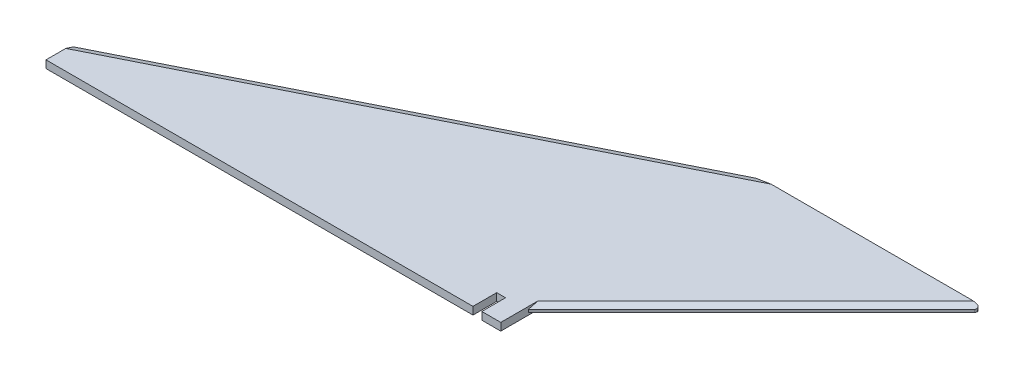
from build123d import *
from OCP.BRepFilletAPI import BRepFilletAPI_MakeChamfer

# Parameters (mm, degrees)
BOSS_EXTRUDE1_DEPTH = 3
CHAMFER1_SIZE       = 1
CHAMFER1_SIZE2      = 2.747477419
CHAMFER2_SIZE       = 1
CHAMFER2_SIZE2      = 2.747477419
FILLET1_R           = 1


with BuildPart() as part:
    # Sketch1 → Boss-Extrude1 (new body)
    with BuildSketch(Plane(origin=(0, 0, 0), x_dir=(1, 0, 0), z_dir=(0, 1, 0))):
        Polygon((0, 0), (0, 10.9), (180, 100.9), (270, 100.9), (180, 10.9), (180, 0), (172.5, 0), (172.5, 9.4), (169, 9.4), (169, 0), align=None)
    extrude(amount=BOSS_EXTRUDE1_DEPTH)

    # Chamfer1: one chamfer whose edges measure the first distance from different faces: ONE call of the kernel's chamfer builder (chamfer() names one face for all edges)
    chamfer1_edges_1 = [part.edges().sort_by_distance(p)[0] for p in [
        (225, 3, -55.9),
    ]]
    chamfer1_side_1 = [part.faces().sort_by_distance(p)[0] for p in [
        (225, 1.5, -55.9),
    ]]
    chamfer1_edges_2 = [part.edges().sort_by_distance(p)[0] for p in [
        (90, 3, -55.9),
    ]]
    chamfer1_side_2 = [part.faces().sort_by_distance(p)[0] for p in [
        (90, 1.5, -55.9),
    ]]
    chamfer1 = BRepFilletAPI_MakeChamfer(part.part.solid().wrapped)
    for e in chamfer1_edges_1:
        chamfer1.Add(CHAMFER1_SIZE, CHAMFER1_SIZE2, e.wrapped, chamfer1_side_1[0].wrapped)  # the first distance lies on this face
    for e in chamfer1_edges_2:
        chamfer1.Add(CHAMFER1_SIZE, CHAMFER1_SIZE2, e.wrapped, chamfer1_side_2[0].wrapped)  # the first distance lies on this face
    add(Compound.cast(chamfer1.Shape()), mode=Mode.REPLACE)

    # Chamfer2: one chamfer whose edges measure the first distance from different faces: ONE call of the kernel's chamfer builder (chamfer() names one face for all edges)
    chamfer2_edges_1 = [part.edges().sort_by_distance(p)[0] for p in [
        (90, 0, -55.9),
    ]]
    chamfer2_side_1 = [part.faces().sort_by_distance(p)[0] for p in [
        (90, 1, -55.9),
    ]]
    chamfer2_edges_2 = [part.edges().sort_by_distance(p)[0] for p in [
        (225, 0, -55.9),
    ]]
    chamfer2_side_2 = [part.faces().sort_by_distance(p)[0] for p in [
        (225, 1, -55.9),
    ]]
    chamfer2 = BRepFilletAPI_MakeChamfer(part.part.solid().wrapped)
    for e in chamfer2_edges_1:
        chamfer2.Add(CHAMFER2_SIZE, CHAMFER2_SIZE2, e.wrapped, chamfer2_side_1[0].wrapped)  # the first distance lies on this face
    for e in chamfer2_edges_2:
        chamfer2.Add(CHAMFER2_SIZE, CHAMFER2_SIZE2, e.wrapped, chamfer2_side_2[0].wrapped)  # the first distance lies on this face
    add(Compound.cast(chamfer2.Shape()), mode=Mode.REPLACE)

    # Fillet1
    fillet1_edges = [part.edges().sort_by_distance(p)[0] for p in [
        (270, 1.5, -100.9),
    ]]
    fillet(fillet1_edges, radius=FILLET1_R)


solid = part.part
